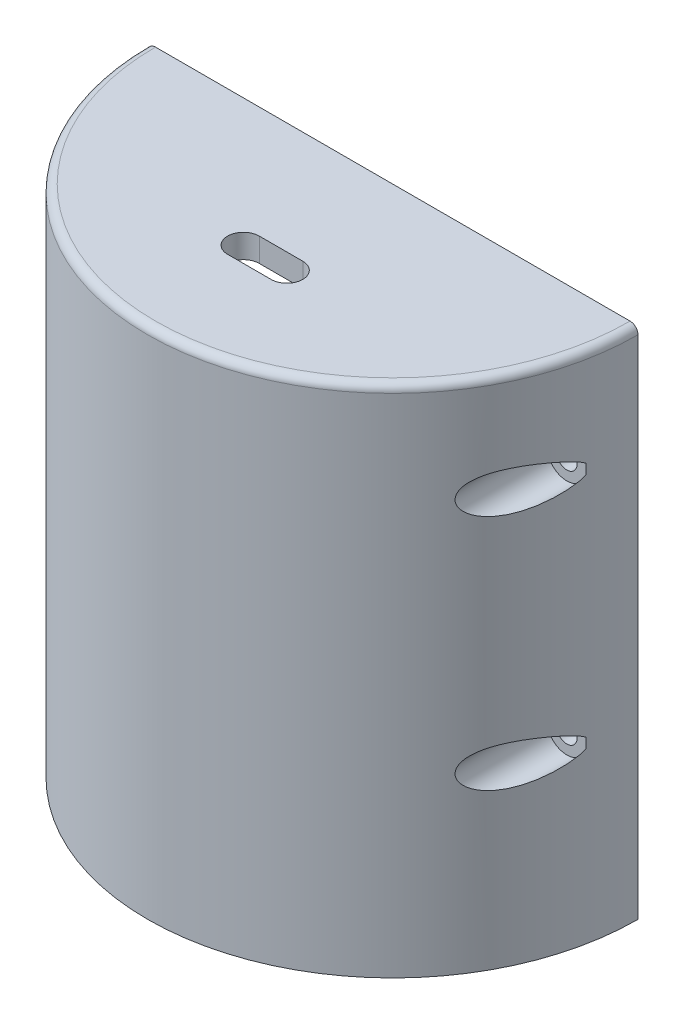
from build123d import *

# Parameters (mm, degrees)
EXTRUDE_1_DEPTH     = 65
EXTRUDE_5_REACH     = 80.403
SKETCH_12_R         = 3
SKETCH_16_R         = 1.3
CUT_EXTRUDE_2_DEPTH = 79.402806155
EXTRUDE_START       = -3
EXTRUDE_6_DEPTH     = 3
FILLET_1_R          = 1
CUT_EXTRUDE_3_REACH = 80.403
CUT_EXTRUDE_START   = -6
SKETCH_16_4_R       = 2.5
CUT_EXTRUDE_4_DEPTH = 73.402806151


with BuildPart() as part:
    # Эскиз1 → Бобышка-Вытянуть1 (new body)
    with BuildSketch(Plane(origin=(0, 0, 0), x_dir=(1, 0, 0), z_dir=(0, 1, 0))):
        with BuildLine():
            Line((-31, 0), (-28, 0))
            ThreePointArc((-28, 0), (0, -28), (28, 0))
            Line((28, 0), (31, 0))
            ThreePointArc((31, 0), (0, -31), (-31, 0))
        make_face()
    extrude(amount=EXTRUDE_1_DEPTH)

    # Эскиз12 → Бобышка-Вытянуть5 (add, up to next)
    with BuildSketch(Plane(origin=(0, 0, 0), x_dir=(-1, 0, 0), z_dir=(0, 0, -1)), mode=Mode.PRIVATE) as extrude_5_sk1:
        with Locations((28, 52)):
            Circle(SKETCH_12_R)
    extrude_5_tool1 = extrude(extrude_5_sk1.sketch, amount=-EXTRUDE_5_REACH, mode=Mode.PRIVATE) - part.part
    # Эскиз12 → Бобышка-Вытянуть5 (add, up to next)
    with BuildSketch(Plane(origin=(0, 0, 0), x_dir=(-1, 0, 0), z_dir=(0, 0, -1)), mode=Mode.PRIVATE) as extrude_5_sk2:
        with Locations((28, 22)):
            Circle(SKETCH_12_R)
    extrude_5_tool2 = extrude(extrude_5_sk2.sketch, amount=-EXTRUDE_5_REACH, mode=Mode.PRIVATE) - part.part
    # Эскиз12 → Бобышка-Вытянуть5 (add, up to next)
    with BuildSketch(Plane(origin=(0, 0, 0), x_dir=(-1, 0, 0), z_dir=(0, 0, -1)), mode=Mode.PRIVATE) as extrude_5_sk3:
        with Locations((-28, 52)):
            Circle(SKETCH_12_R)
    extrude_5_tool3 = extrude(extrude_5_sk3.sketch, amount=-EXTRUDE_5_REACH, mode=Mode.PRIVATE) - part.part
    # Эскиз12 → Бобышка-Вытянуть5 (add, up to next)
    with BuildSketch(Plane(origin=(0, 0, 0), x_dir=(-1, 0, 0), z_dir=(0, 0, -1)), mode=Mode.PRIVATE) as extrude_5_sk4:
        with Locations((-28, 22)):
            Circle(SKETCH_12_R)
    extrude_5_tool4 = extrude(extrude_5_sk4.sketch, amount=-EXTRUDE_5_REACH, mode=Mode.PRIVATE) - part.part
    add(extrude_5_tool1.solids().sort_by_distance((-28, 52, 0))[0])
    add(extrude_5_tool2.solids().sort_by_distance((-28, 22, 0))[0])
    add(extrude_5_tool3.solids().sort_by_distance((28, 52, 0))[0])
    add(extrude_5_tool4.solids().sort_by_distance((28, 22, 0))[0])

    # Эскиз16 → Вырез-Вытянуть2 (cut, through all)
    with BuildSketch(Plane(origin=(0, 0, 0), x_dir=(-1, 0, 0), z_dir=(0, 0, -1))):
        with Locations((28, 52)):
            Circle(SKETCH_16_R)
        with Locations((28, 22)):
            Circle(SKETCH_16_R)
        with Locations((-28, 22)):
            Circle(SKETCH_16_R)
        with Locations((-28, 52)):
            Circle(SKETCH_16_R)
    extrude(amount=-CUT_EXTRUDE_2_DEPTH, mode=Mode.SUBTRACT)

    # Эскиз2 → Бобышка-Вытянуть6 (add)
    with BuildSketch(Plane(origin=(0, 65, 0), x_dir=(1, 0, 0), z_dir=(0, 1, 0)).offset(EXTRUDE_START)):
        with BuildLine():
            Line((-31, 0), (31, 0))
            ThreePointArc((31, 0), (0, -31), (-31, 0))
        make_face()
    extrude(amount=EXTRUDE_6_DEPTH)

    # Скругление1
    fillet_1_edges = [part.edges().sort_by_distance(p)[0] for p in [
        (0, 65, 31),
    ]]
    fillet(fillet_1_edges, radius=FILLET_1_R)

    # Эскиз18 → Вырез-Вытянуть3 (cut, up to next)
    with BuildSketch(Plane(origin=(0, 65, 0), x_dir=(1, 0, 0), z_dir=(0, 1, 0)), mode=Mode.PRIVATE) as cut_extrude_3_sk1:
        with BuildLine():
            Line((-2.75, -14.13), (2.75, -14.13))
            ThreePointArc((2.75, -14.13), (4.75, -16.13), (2.75, -18.13))
            Line((2.75, -18.13), (-2.75, -18.13))
            ThreePointArc((-2.75, -18.13), (-4.75, -16.13), (-2.75, -14.13))
        make_face()
    cut_extrude_3_tool1 = extrude(cut_extrude_3_sk1.sketch, amount=-CUT_EXTRUDE_3_REACH, mode=Mode.PRIVATE) & part.part
    add(cut_extrude_3_tool1.solids().sort_by_distance((0, 65, 16.13))[0], mode=Mode.SUBTRACT)

    # Эскиз16<4> → Вырез-Вытянуть4 (cut, through all)
    with BuildSketch(Plane(origin=(0, 0, 0), x_dir=(-1, 0, 0), z_dir=(0, 0, -1)).offset(CUT_EXTRUDE_START)):
        with Locations((-28, 52)):
            Circle(SKETCH_16_4_R)
        with Locations((-28, 22)):
            Circle(SKETCH_16_4_R)
        with Locations((28, 22)):
            Circle(SKETCH_16_4_R)
        with Locations((28, 52)):
            Circle(SKETCH_16_4_R)
    extrude(amount=-CUT_EXTRUDE_4_DEPTH, mode=Mode.SUBTRACT)


solid = part.part
